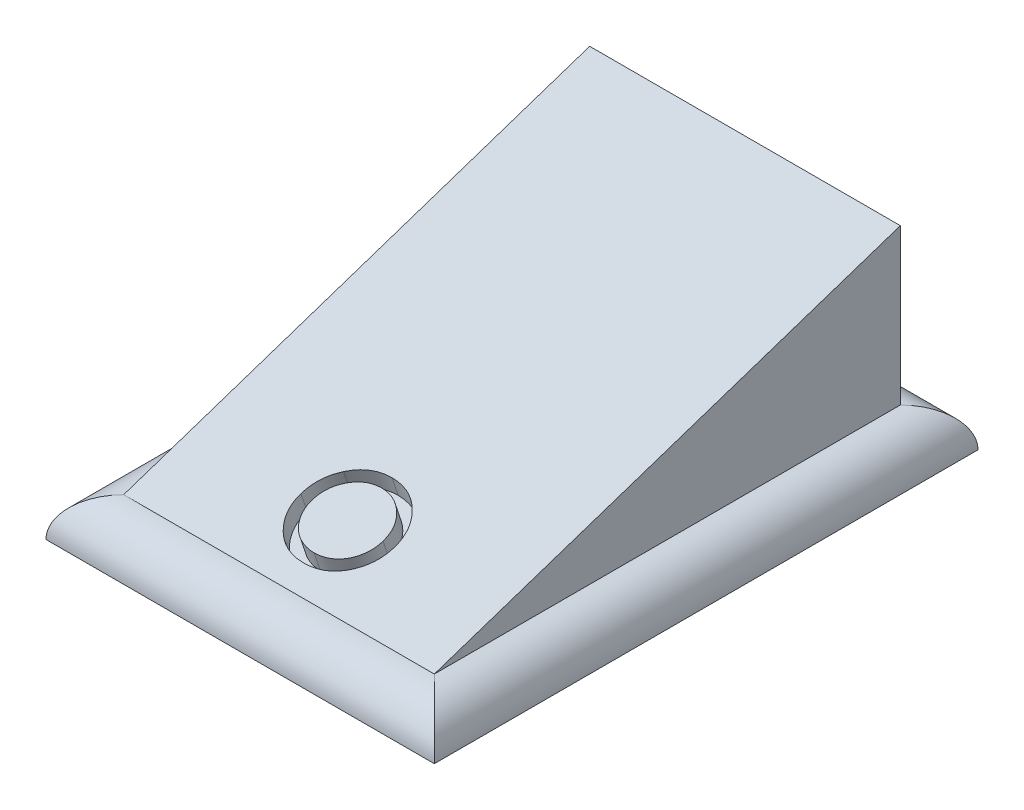
from build123d import *

# Parameters (mm, degrees)
SKETCH1_W           = 10
SKETCH1_H           = 14
BOSS_EXTRUDE1_DEPTH = 1
SKETCH2_W           = 8
SKETCH2_H           = 12
BOSS_EXTRUDE2_DEPTH = 4
CUT_EXTRUDE1_DEPTH  = 8
CUT_EXTRUDE2_DEPTH  = 0.5
FILLET1_R           = 1


with BuildPart() as part:
    # Sketch1 → Boss-Extrude1 (new body)
    with BuildSketch(Plane(origin=(0, 0, 0), x_dir=(1, 0, 0), z_dir=(0, 1, 0))):
        with Locations((5, 7)):
            Rectangle(SKETCH1_W, SKETCH1_H)
    extrude(amount=BOSS_EXTRUDE1_DEPTH)

    # Sketch2 → Boss-Extrude2 (add)
    with BuildSketch(Plane(origin=(0, 1, 0), x_dir=(1, 0, 0), z_dir=(0, 1, 0))):
        with Locations((5, 7)):
            Rectangle(SKETCH2_W, SKETCH2_H)
    extrude(amount=BOSS_EXTRUDE2_DEPTH)

    # Sketch3 → Cut-Extrude1 (cut)
    with BuildSketch(Plane.ZY.offset(-1)):
        Polygon((-13, 5), (-1, 1), (-1, 5), align=None)
    extrude(amount=-CUT_EXTRUDE1_DEPTH, mode=Mode.SUBTRACT)

    # Sketch4 → Cut-Extrude2 (cut)
    with BuildSketch(Plane(origin=(0, 0.6, 0.2), x_dir=(1, 0, 0), z_dir=(0, 0.9486832980505139, 0.3162277660168379))):
        with BuildLine():
            add(Edge.make_bspline(
                [(5.03786558, 4.295135467), (5.08140052, 4.294208466), (5.166761899, 4.292390843), (5.291773338, 4.27296441), (5.411103569, 4.243257872), (5.525209614, 4.202190098), (5.632630111, 4.1471429), (5.73492974, 4.081457329), (5.831828026, 4.003640262), (5.88990606, 3.943444014), (5.919386013, 3.912888873)],
                knots=[0, 0, 0, 0, 1.054011418, 2.066658804, 3.057071809, 4.030435133, 4.997543892, 5.974964718, 6.972108034, 8, 8, 8, 8], degree=3))
            add(Edge.make_bspline(
                [(5.919386013, 3.912888873), (5.944769642, 3.883666186), (5.995045659, 3.825786351), (6.059512418, 3.73193733), (6.115049119, 3.634745954), (6.159556233, 3.532921593), (6.194649076, 3.427353141), (6.219564387, 3.317677745), (6.23438432, 3.204137616), (6.236382726, 3.127026992), (6.237394827, 3.087974009)],
                knots=[0, 0, 0, 0, 1.025258237, 2.030674902, 3.01204498, 3.988269485, 4.97094183, 5.956517959, 6.965070386, 8, 8, 8, 8], degree=3))
            add(Edge.make_bspline(
                [(6.237394827, 3.087974009), (6.236504614, 3.048694671), (6.234745511, 2.971076867), (6.21810523, 2.856759299), (6.192223459, 2.745911139), (6.155183149, 2.638996467), (6.107686864, 2.535688473), (6.049728883, 2.436438382), (5.980902488, 2.341050376), (5.902884577, 2.250334422), (5.816658946, 2.166726499), (5.723117869, 2.093857283), (5.624099567, 2.031426329), (5.518287382, 1.98113758), (5.40664759, 1.941486638), (5.288939393, 1.913637337), (5.16534565, 1.896799238), (5.080956671, 1.894636997), (5.03786558, 1.893532903)],
                knots=[0, 0, 0, 0, 0.998656419, 1.973391657, 2.932242238, 3.890759089, 4.846373663, 5.82037756, 6.809684879, 7.83454468, 8.860553229, 9.859544525, 10.845671541, 11.83227036, 12.833544569, 13.85385346, 14.904124723, 16, 16, 16, 16], degree=3))
            add(Edge.make_bspline(
                [(5.03786558, 1.893532903), (4.99456337, 1.894640703), (4.909753804, 1.896810384), (4.785723807, 1.913571919), (4.667804652, 1.941473803), (4.556018709, 1.981267886), (4.449751598, 2.031427936), (4.350159562, 2.09366854), (4.256542495, 2.166748109), (4.170298624, 2.250328567), (4.092285603, 2.341051884), (4.023457946, 2.436437991), (3.965500293, 2.535688575), (3.918003922, 2.63899644), (3.880963635, 2.745911146), (3.855081858, 2.856759298), (3.838441579, 2.971076868), (3.836682476, 3.048694671), (3.835792263, 3.087974009)],
                knots=[0, 0, 0, 0, 1.099876186, 2.154163076, 3.173186993, 4.173200201, 5.163417411, 6.152872554, 7.150605724, 8.17532212, 9.198891216, 10.186952605, 11.159729845, 12.11414092, 13.071450619, 14.029093627, 15.002601286, 16, 16, 16, 16], degree=3))
            add(Edge.make_bspline(
                [(3.835792263, 3.087974009), (3.836811266, 3.126814733), (3.838828716, 3.203712691), (3.853633749, 3.317039381), (3.878451869, 3.426529156), (3.913586778, 3.531690123), (3.95850413, 3.633068269), (4.013260441, 3.730499794), (4.078384801, 3.823924442), (4.128460857, 3.881729471), (4.153801077, 3.91098082)],
                knots=[0, 0, 0, 0, 1.031353054, 2.041901799, 3.029428768, 4.008703097, 4.981709435, 5.96992636, 6.972712378, 8, 8, 8, 8], degree=3))
            add(Edge.make_bspline(
                [(4.153801077, 3.91098082), (4.183236584, 3.941800943), (4.241126689, 4.002414139), (4.338507321, 4.080004357), (4.440555287, 4.147056796), (4.549162899, 4.20101022), (4.663175206, 4.243499447), (4.783116947, 4.273041021), (4.908552593, 4.29232085), (4.994331678, 4.294187911), (5.03786558, 4.295135467)],
                knots=[0, 0, 0, 0, 1.027980169, 2.021703884, 2.998553061, 3.971491411, 4.943284454, 5.930300938, 6.949603206, 8, 8, 8, 8], degree=3))
        make_face()
        with BuildLine():
            add(Edge.make_bspline(
                [(5.036593545, 4.01019957), (5.005807283, 4.009324547), (4.945029502, 4.007597091), (4.85556745, 3.99445812), (4.769443168, 3.973641456), (4.686493259, 3.944064919), (4.606997453, 3.905875204), (4.530879638, 3.858968334), (4.457915924, 3.803965581), (4.389533624, 3.740953014), (4.326775384, 3.672119926), (4.271913219, 3.598778915), (4.225263301, 3.522119587), (4.186401157, 3.442062224), (4.157456779, 3.357795534), (4.136435537, 3.270273819), (4.123308962, 3.179318762), (4.121597747, 3.117486981), (4.12072816, 3.086065956)],
                knots=[0, 0, 0, 0, 1.021534396, 2.016698045, 2.994645724, 3.958388632, 4.93408049, 5.916473867, 6.921342795, 7.962252576, 8.998418191, 10.008913653, 10.997312074, 11.973003931, 12.956656626, 13.948281152, 14.957379055, 16, 16, 16, 16], degree=3))
            add(Edge.make_bspline(
                [(4.12072816, 3.086065956), (4.122185779, 3.045469474), (4.125078879, 2.964893049), (4.148605843, 2.846228674), (4.187963397, 2.732307994), (4.24111043, 2.623798843), (4.307700357, 2.523403277), (4.386156481, 2.433894145), (4.475636781, 2.356618444), (4.575074606, 2.29250082), (4.68243888, 2.241555899), (4.796064257, 2.205452542), (4.91457403, 2.181983221), (4.995564407, 2.179650527), (5.036593545, 2.178468801)],
                knots=[0, 0, 0, 0, 1.016792936, 2.018143844, 3.017858371, 4.030088057, 5.03801393, 6.028138512, 7.003788237, 7.991172063, 8.984598303, 9.972568034, 10.972917682, 12, 12, 12, 12], degree=3))
            add(Edge.make_bspline(
                [(5.036593545, 2.178468801), (5.077620322, 2.179657412), (5.158606041, 2.182003698), (5.276951152, 2.205334341), (5.390265969, 2.241714091), (5.497518728, 2.292443524), (5.596911289, 2.356861929), (5.687035135, 2.433457785), (5.764821375, 2.52364035), (5.831345431, 2.623931823), (5.885362834, 2.732139771), (5.924536167, 2.846249699), (5.948119691, 2.964887694), (5.951005157, 3.04546768), (5.952458929, 3.086065956)],
                knots=[0, 0, 0, 0, 1.02726834, 2.027799167, 3.010890988, 4.004497153, 4.992059811, 5.971914811, 6.958719428, 7.966827853, 8.981595046, 9.981490638, 10.983022906, 12, 12, 12, 12], degree=3))
            add(Edge.make_bspline(
                [(5.952458929, 3.086065956), (5.951589641, 3.117487169), (5.949879016, 3.179319319), (5.936748155, 3.270271688), (5.915742773, 3.357803351), (5.886739949, 3.442033382), (5.848046665, 3.522326868), (5.800497145, 3.598553835), (5.745859001, 3.672373988), (5.68234347, 3.740730505), (5.614032548, 3.803990145), (5.541039264, 3.858989662), (5.465034319, 3.905669053), (5.385769462, 3.944391571), (5.302808918, 3.973372372), (5.216805308, 3.994578317), (5.127724959, 4.007541566), (5.06716497, 4.009307902), (5.036593545, 4.01019957)],
                knots=[0, 0, 0, 0, 1.042956736, 2.052379634, 3.044323526, 4.02829302, 5.004299113, 5.996692471, 7.007513377, 8.048758398, 9.090003419, 10.095195979, 11.07790575, 12.047570684, 13.018257071, 13.989683339, 14.985167495, 16, 16, 16, 16], degree=3))
        make_face(mode=Mode.SUBTRACT)
    extrude(amount=-CUT_EXTRUDE2_DEPTH, mode=Mode.SUBTRACT)

    # Fillet1
    fillet1_edges = [part.edges().sort_by_distance(p)[0] for p in [
        (5, 1, -14),
        (10, 1, -7),
        (5, 1, 0),
        (0, 1, -7),
    ]]
    fillet(fillet1_edges, radius=FILLET1_R - 0.0001)  # a hair under: the kernel refuses the full size


solid = part.part
